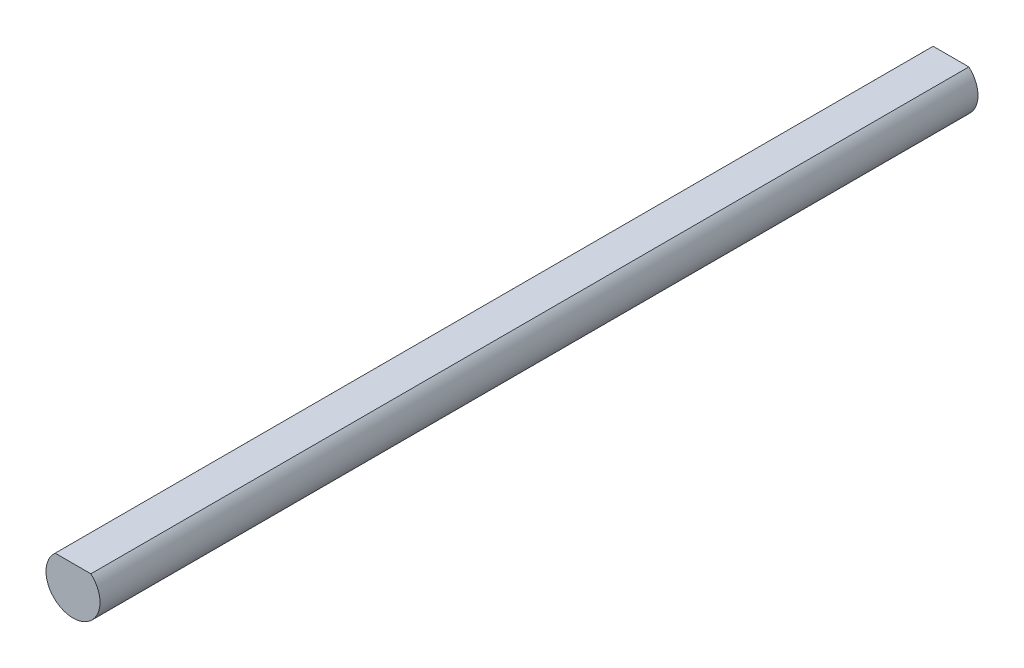
from build123d import *

# Parameters (mm, degrees)
SKETCH1_R           = 4
BOSS_EXTRUDE1_DEPTH = 130
CUT_EXTRUDE1_REACH  = 132.123


with BuildPart() as part:
    # Sketch1 → Boss-Extrude1 (new body)
    with BuildSketch(Plane.XY):
        Circle(SKETCH1_R)
    extrude(amount=BOSS_EXTRUDE1_DEPTH)

    # Sketch2 → Cut-Extrude1 (cut, up to next)
    with BuildSketch(Plane.XY.offset(130), mode=Mode.PRIVATE) as cut_extrude1_sk1:
        with BuildLine():
            Line((-2.645751311, 3), (2.645751311, 3))
            ThreePointArc((2.645751311, 3), (0, 4), (-2.645751311, 3))
        make_face()
    cut_extrude1_tool1 = extrude(cut_extrude1_sk1.sketch, amount=-CUT_EXTRUDE1_REACH, mode=Mode.PRIVATE) & part.part
    add(cut_extrude1_tool1.solids().sort_by_distance((0, 3.404621, 130))[0], mode=Mode.SUBTRACT)


solid = part.part
